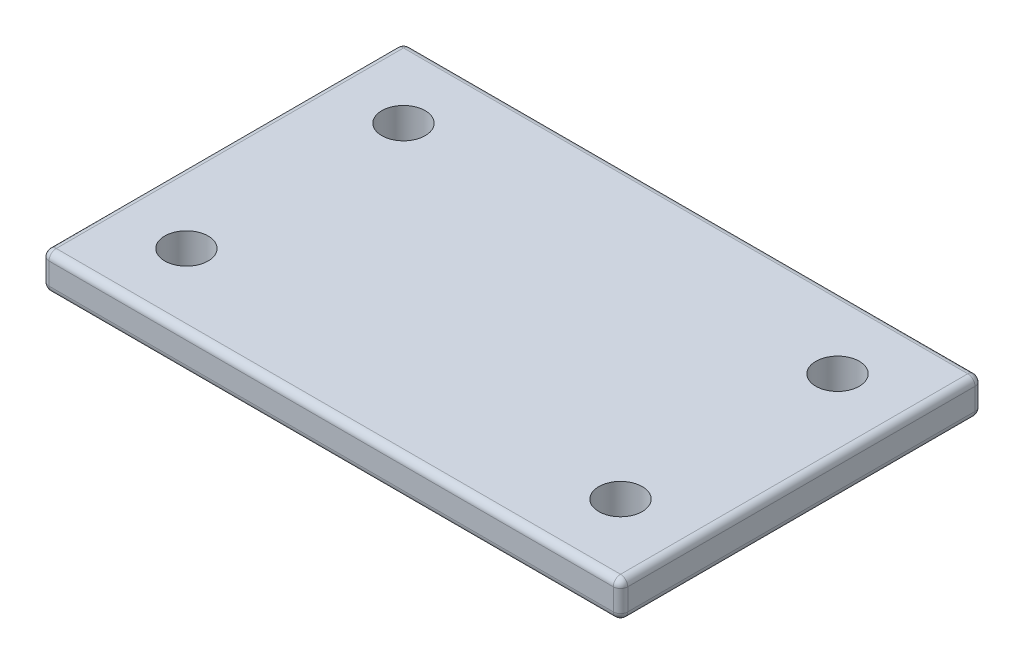
from build123d import *

# Parameters (mm, degrees)
SKETCH1_W           = 160
SKETCH1_H           = 100
BOSS_EXTRUDE1_DEPTH = 10
SKETCH2_R           = 6
CUT_EXTRUDE1_DEPTH  = 95.868329805
FILLET1_R           = 2
FILLET2_R           = 2
FILLET3_R           = 2


with BuildPart() as part:
    # Sketch1 → Boss-Extrude1 (new body)
    with BuildSketch(Plane(origin=(0, 0, 0), x_dir=(1, 0, 0), z_dir=(0, 1, 0))):
        Rectangle(SKETCH1_W, SKETCH1_H)
    extrude(amount=BOSS_EXTRUDE1_DEPTH)

    # Sketch2 → Cut-Extrude1 (cut, through all)
    with BuildSketch(Plane(origin=(0, 10, 0), x_dir=(1, 0, 0), z_dir=(0, 1, 0))):
        with Locations(Location((-60, 30, 0), (0, 0, 270))):
            Circle(SKETCH2_R)
        with Locations(Location((-60, -30, 0), (0, 0, 270))):
            Circle(SKETCH2_R)
        with Locations(Location((60, -30, 0), (0, 0, 90))):
            Circle(SKETCH2_R)
        with Locations(Location((60, 30, 0), (0, 0, 90))):
            Circle(SKETCH2_R)
    extrude(amount=-CUT_EXTRUDE1_DEPTH, mode=Mode.SUBTRACT)

    # Fillet1
    fillet1_edges = [part.edges().sort_by_distance(p)[0] for p in [
        (-80, 10, 0),
        (0, 10, 50),
        (80, 10, 0),
        (0, 10, -50),
    ]]
    fillet(fillet1_edges, radius=FILLET1_R)

    # Fillet2
    fillet2_edges = [part.edges().sort_by_distance(p)[0] for p in [
        (0, 0, 50),
        (-80, 0, 0),
        (0, 0, -50),
        (80, 0, 0),
    ]]
    fillet(fillet2_edges, radius=FILLET2_R)

    # Fillet3
    # the kernel refuses this fillet: 2 mm, written as the material it takes off along each edge
    with BuildSketch(Plane(origin=(-78, 8, 48), x_dir=(-1, 0, 0), z_dir=(0, 0, 1))) as fillet3_piece_1_section:
        Polygon((0, 0), (FILLET3_R, 0), (FILLET3_R, -FILLET3_R), (0, -FILLET3_R), align=None)
    fillet3_piece_1 = extrude(amount=FILLET3_R, mode=Mode.PRIVATE)
    fillet3_piece_1 = fillet3_piece_1 - Plane(origin=(-78, 8, 48), x_dir=(0.7071067811865475, -0.7071067811865475, 0), z_dir=(0, 0, 1)) * Sphere(FILLET3_R, mode=Mode.PRIVATE)
    add(fillet3_piece_1, mode=Mode.SUBTRACT)
    with BuildSketch(Plane(origin=(-78, 8, -48), x_dir=(0, 0, -1), z_dir=(-1, 0, 0))) as fillet3_piece_2_section:
        Polygon((0, 0), (FILLET3_R, 0), (FILLET3_R, -FILLET3_R), (0, -FILLET3_R), align=None)
    fillet3_piece_2 = extrude(amount=FILLET3_R, mode=Mode.PRIVATE)
    fillet3_piece_2 = fillet3_piece_2 - Plane(origin=(-78, 8, -48), x_dir=(0, -0.7071067811865475, 0.7071067811865475), z_dir=(-1, 0, 0)) * Sphere(FILLET3_R, mode=Mode.PRIVATE)
    add(fillet3_piece_2, mode=Mode.SUBTRACT)
    with BuildSketch(Plane(origin=(78, 8, 48), x_dir=(1, 0, 0), z_dir=(0, 0, 1))) as fillet3_piece_3_section:
        Polygon((0, 0), (FILLET3_R, 0), (FILLET3_R, FILLET3_R), (0, FILLET3_R), align=None)
    fillet3_piece_3 = extrude(amount=FILLET3_R, mode=Mode.PRIVATE)
    fillet3_piece_3 = fillet3_piece_3 - Plane(origin=(78, 8, 48), x_dir=(-0.7071067811865475, -0.7071067811865475, 0), z_dir=(0, 0, 1)) * Sphere(FILLET3_R, mode=Mode.PRIVATE)
    add(fillet3_piece_3, mode=Mode.SUBTRACT)
    with BuildSketch(Plane(origin=(78, 8, -48), x_dir=(0, 0, -1), z_dir=(1, 0, 0))) as fillet3_piece_4_section:
        Polygon((0, 0), (FILLET3_R, 0), (FILLET3_R, FILLET3_R), (0, FILLET3_R), align=None)
    fillet3_piece_4 = extrude(amount=FILLET3_R, mode=Mode.PRIVATE)
    fillet3_piece_4 = fillet3_piece_4 - Plane(origin=(78, 8, -48), x_dir=(0, -0.7071067811865475, 0.7071067811865475), z_dir=(1, 0, 0)) * Sphere(FILLET3_R, mode=Mode.PRIVATE)
    add(fillet3_piece_4, mode=Mode.SUBTRACT)
    with BuildSketch(Plane(origin=(-78, 2, 48), x_dir=(-1, 0, 0), z_dir=(0, 0, 1))) as fillet3_piece_5_section:
        Polygon((0, 0), (FILLET3_R, 0), (FILLET3_R, FILLET3_R), (0, FILLET3_R), align=None)
    fillet3_piece_5 = extrude(amount=FILLET3_R, mode=Mode.PRIVATE)
    fillet3_piece_5 = fillet3_piece_5 - Plane(origin=(-78, 2, 48), x_dir=(0.7071067811865475, 0.7071067811865475, 0), z_dir=(0, 0, 1)) * Sphere(FILLET3_R, mode=Mode.PRIVATE)
    add(fillet3_piece_5, mode=Mode.SUBTRACT)
    with BuildSketch(Plane(origin=(-78, 2, -48), x_dir=(0, 0, -1), z_dir=(-1, 0, 0))) as fillet3_piece_6_section:
        Polygon((0, 0), (FILLET3_R, 0), (FILLET3_R, FILLET3_R), (0, FILLET3_R), align=None)
    fillet3_piece_6 = extrude(amount=FILLET3_R, mode=Mode.PRIVATE)
    fillet3_piece_6 = fillet3_piece_6 - Plane(origin=(-78, 2, -48), x_dir=(0, 0.7071067811865475, 0.7071067811865475), z_dir=(-1, 0, 0)) * Sphere(FILLET3_R, mode=Mode.PRIVATE)
    add(fillet3_piece_6, mode=Mode.SUBTRACT)
    with BuildSketch(Plane(origin=(78, 2, 48), x_dir=(1, 0, 0), z_dir=(0, 0, 1))) as fillet3_piece_7_section:
        Polygon((0, 0), (FILLET3_R, 0), (FILLET3_R, -FILLET3_R), (0, -FILLET3_R), align=None)
    fillet3_piece_7 = extrude(amount=FILLET3_R, mode=Mode.PRIVATE)
    fillet3_piece_7 = fillet3_piece_7 - Plane(origin=(78, 2, 48), x_dir=(-0.7071067811865475, 0.7071067811865475, 0), z_dir=(0, 0, 1)) * Sphere(FILLET3_R, mode=Mode.PRIVATE)
    add(fillet3_piece_7, mode=Mode.SUBTRACT)
    with BuildSketch(Plane(origin=(78, 2, -48), x_dir=(0, 0, -1), z_dir=(1, 0, 0))) as fillet3_piece_8_section:
        Polygon((0, 0), (FILLET3_R, 0), (FILLET3_R, -FILLET3_R), (0, -FILLET3_R), align=None)
    fillet3_piece_8 = extrude(amount=FILLET3_R, mode=Mode.PRIVATE)
    fillet3_piece_8 = fillet3_piece_8 - Plane(origin=(78, 2, -48), x_dir=(0, 0.7071067811865475, 0.7071067811865475), z_dir=(1, 0, 0)) * Sphere(FILLET3_R, mode=Mode.PRIVATE)
    add(fillet3_piece_8, mode=Mode.SUBTRACT)
    with BuildSketch(Plane(origin=(80, 2, -50), x_dir=(0, 0, 1), z_dir=(0, 1, 0)), Plane(origin=(80, 2, 50), x_dir=(-1, 0, 0), z_dir=(0, 1, 0))) as fillet3_piece_9:
        with BuildLine():
            CenterArc((FILLET3_R, -FILLET3_R), FILLET3_R, 90, 90)
            Line((0, -FILLET3_R), (0, 0))
            Line((0, 0), (FILLET3_R, 0))
        make_face()
    extrude(amount=6, mode=Mode.SUBTRACT)
    with BuildSketch(Plane(origin=(-80, 2, 50), x_dir=(1, 0, 0), z_dir=(0, 1, 0)), Plane(origin=(-80, 2, -50), x_dir=(0, 0, 1), z_dir=(0, 1, 0))) as fillet3_piece_10:
        with BuildLine():
            CenterArc((FILLET3_R, FILLET3_R), FILLET3_R, 180, 90)
            Line((0, FILLET3_R), (0, 0))
            Line((0, 0), (FILLET3_R, 0))
        make_face()
    extrude(amount=6, mode=Mode.SUBTRACT)


solid = part.part
